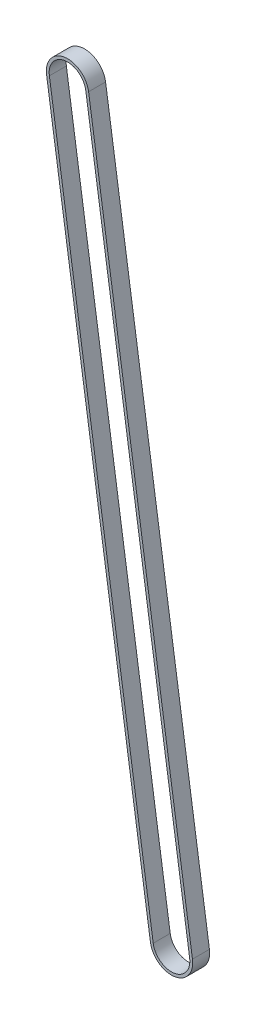
from build123d import *

# Parameters (mm, degrees)
THICKEN1_START = 0.5
THICKEN1_DEPTH = 6


# Read off the part's stored shape, not the designer's step: Thicken1
with BuildPart() as part:
    # Thicken1 outline → Thicken1 (new body)
    with BuildSketch(Plane.XY.offset(THICKEN1_START)):
        with BuildLine():
            Line((-44.084142674, 245.790557606), (-7.418638396, -1.101727894))
            ThreePointArc((-7.418638396, -1.101727894), (1.101727894, -7.418638396), (7.418638396, 1.101727894))
            Line((7.418638396, 1.101727894), (-29.246865883, 247.994013395))
            ThreePointArc((-29.246865883, 247.994013395), (-37.767232173, 254.310923896), (-44.084142674, 245.790557606))
        make_face()
        with BuildLine():
            ThreePointArc((6.42948661, 0.954830842), (0.954830842, -6.42948661), (-6.42948661, -0.954830842))
            Line((-6.42948661, -0.954830842), (-43.094990888, 245.937454659))
            ThreePointArc((-43.094990888, 245.937454659), (-37.62033512, 253.32177211), (-30.236017669, 247.847116343))
            Line((-30.236017669, 247.847116343), (6.42948661, 0.954830842))
        make_face(mode=Mode.SUBTRACT)
    extrude(amount=THICKEN1_DEPTH)


solid = part.part
